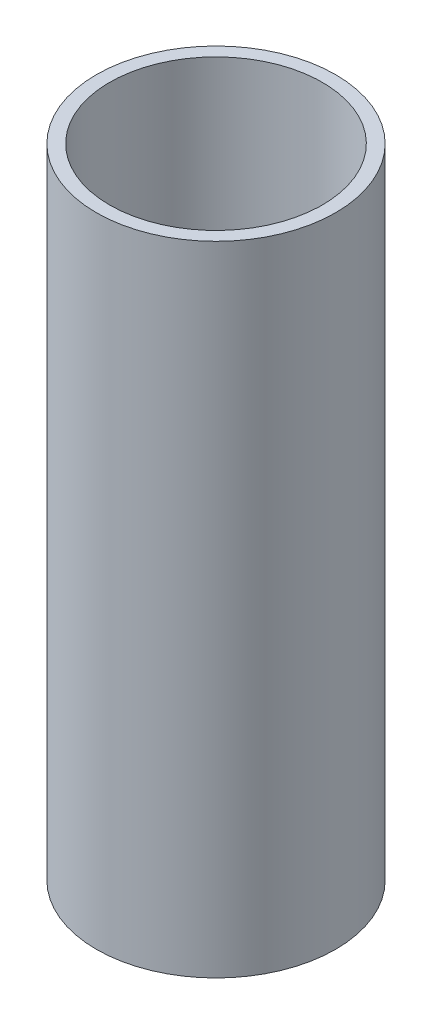
from build123d import *

# Parameters (mm, degrees)
SKETCH1_R               = 90
FULL_CASING_DEPTH       = 480
SKETCH2_R               = 80
ELECTRONICS_SPACE_DEPTH = 235
BLADDER_START           = -235
SKETCH3_R               = 80
BLADDER_SPACE_DEPTH     = 235


with BuildPart() as part:
    # Sketch1 → Full Casing (new body)
    with BuildSketch(Plane(origin=(0, 0, 0), x_dir=(1, 0, 0), z_dir=(0, 1, 0))):
        Circle(SKETCH1_R)
    extrude(amount=FULL_CASING_DEPTH)

    # Sketch2 → Electronics Space (cut)
    with BuildSketch(Plane.XZ):
        Circle(SKETCH2_R)
    extrude(amount=-ELECTRONICS_SPACE_DEPTH, mode=Mode.SUBTRACT)

    # Sketch3 → Bladder Space (cut)
    with BuildSketch(Plane(origin=(0, 480, 0), x_dir=(1, 0, 0), z_dir=(0, 1, 0)).offset(BLADDER_START)):
        Circle(SKETCH3_R)
    extrude(amount=BLADDER_SPACE_DEPTH, mode=Mode.SUBTRACT)


solid = part.part
